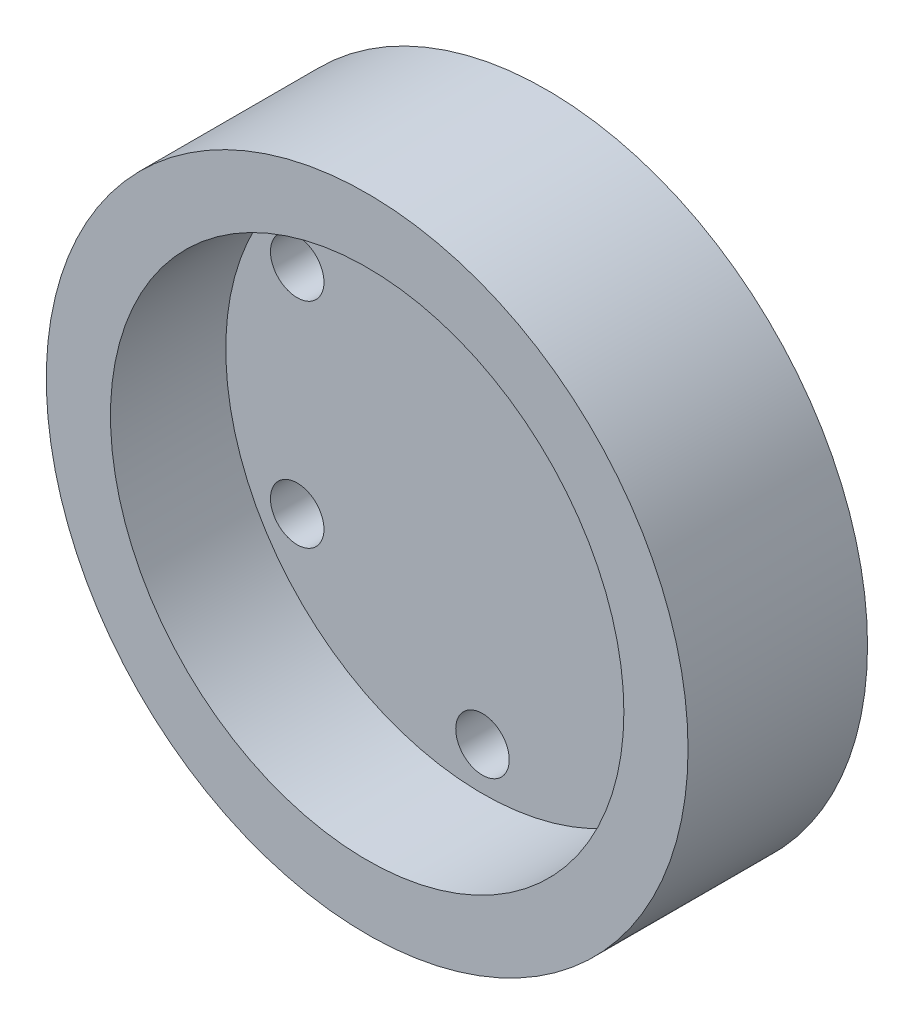
from build123d import *

# Parameters (mm, degrees)
SKETCH2_R           = 15
BOSS_EXTRUDE1_DEPTH = 8.39
SHELL1_T            = -3
SKETCH3_R           = 1.25
CUT_EXTRUDE1_DEPTH  = 5


with BuildPart() as part:
    # Sketch2 → Boss-Extrude1 (new body)
    with BuildSketch(Plane.XY):
        Circle(SKETCH2_R)
    extrude(amount=BOSS_EXTRUDE1_DEPTH)

    # Shell1
    shell1_openings = [part.faces().sort_by_distance(p)[0] for p in [
        (0, 0, 8.39),
    ]]
    offset(amount=SHELL1_T, openings=shell1_openings, kind=Kind.INTERSECTION)

    # Sketch3 → Cut-Extrude1 (cut)
    with BuildSketch(Plane(origin=(0, 0, 0), x_dir=(-1, 0, 0), z_dir=(0, 0, -1))):
        with Locations((0, 10)):
            Circle(SKETCH3_R)
        with Locations((8.660254038, 5)):
            Circle(SKETCH3_R)
        with Locations((8.660254038, -5)):
            Circle(SKETCH3_R)
        with Locations((0, -10)):
            Circle(SKETCH3_R)
        with Locations((-8.660254038, -5)):
            Circle(SKETCH3_R)
        with Locations((-8.660254038, 5)):
            Circle(SKETCH3_R)
    extrude(amount=-CUT_EXTRUDE1_DEPTH, mode=Mode.SUBTRACT)


solid = part.part
